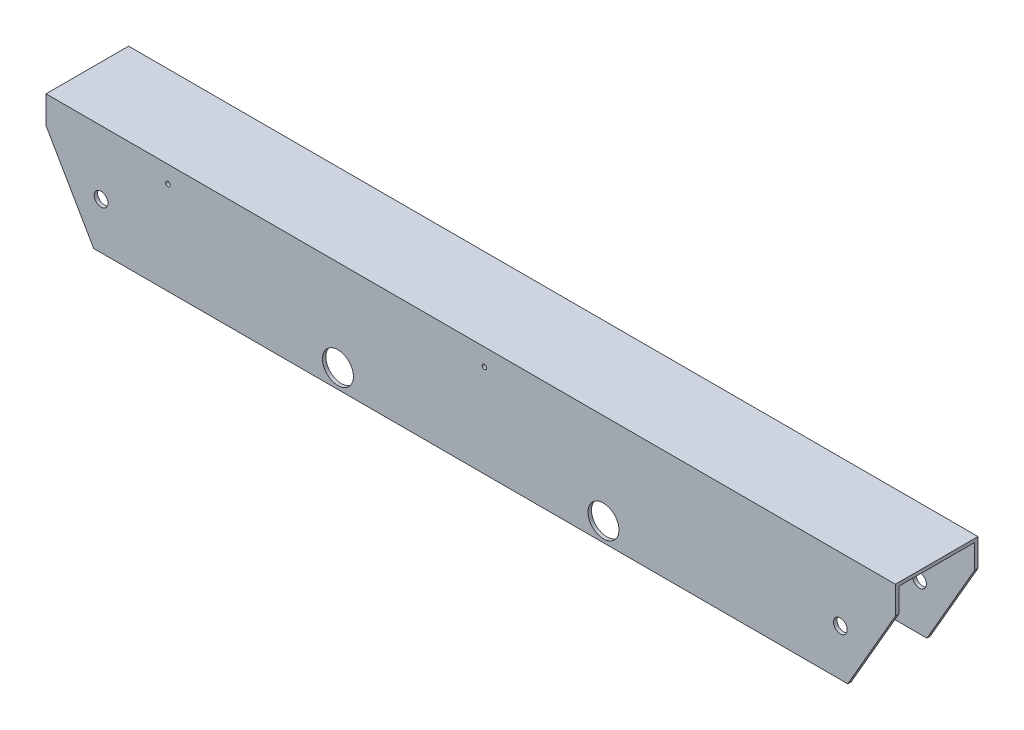
from build123d import *

# Parameters (mm, degrees)
BOSS_EXTRUDE1_DEPTH = 391.865756272
SKETCH2_R           = 6.35
SKETCH2_R_2         = 14.2875
SKETCH2_R_3         = 2.0828
CUT_EXTRUDE1_DEPTH  = 141.732
SKETCH14_R          = 3.302
SKETCH14_W          = 25.4
SKETCH14_H          = 25.4
CUT_EXTRUDE12_DEPTH = 23.114
CUT_EXTRUDE13_DEPTH = 101.6


with BuildPart() as part:
    # Sketch1 → Boss-Extrude1 (new, symmetric)
    with BuildSketch(Plane(origin=(0, 0, 0), x_dir=(0, 0, -1), z_dir=(1, 0, 0))):
        Polygon((-38.1, 50.8), (38.1, 50.8), (38.1, -50.8), (34.925, -50.8), (34.925, 47.625), (-34.925, 47.625), (-34.925, -50.8), (-38.1, -50.8), align=None)
    extrude(amount=BOSS_EXTRUDE1_DEPTH, both=True)

    # Sketch2 → Cut-Extrude1 (cut)
    with BuildSketch(Plane.XY.offset(38.1)):
        with Locations((-341.065756187, -7.9375)):
            Circle(SKETCH2_R)
        with Locations((122.51182, -33.3375)):
            Circle(SKETCH2_R_2)
        with Locations((341.065756187, -7.9375)):
            Circle(SKETCH2_R)
        with Locations((12.7, 34.925)):
            Circle(SKETCH2_R_3)
        with Locations((-279.4, 34.925)):
            Circle(SKETCH2_R_3)
        with Locations((-122.51182, -33.3375)):
            Circle(SKETCH2_R_2)
    extrude(amount=-CUT_EXTRUDE1_DEPTH, mode=Mode.SUBTRACT)

    # Sketch14 → Cut-Extrude12 (cut)
    with BuildSketch(Plane(origin=(0, 0, -38.1), x_dir=(-1, 0, 0), z_dir=(0, 0, -1))):
        with Locations((-160.61182, -35.123476108)):
            Circle(SKETCH14_R)
        with Locations((-160.61182, 41.076523892)):
            Circle(SKETCH14_R)
        with Locations((-84.41182, 41.076523892)):
            Circle(SKETCH14_R)
        with Locations((-84.41182, -35.123476108)):
            Circle(SKETCH14_R)
        with Locations((-12.7, 34.925)):
            Rectangle(SKETCH14_W, SKETCH14_H)
        with Locations((279.4, 34.925)):
            Rectangle(SKETCH14_W, SKETCH14_H)
    extrude(amount=-CUT_EXTRUDE12_DEPTH, mode=Mode.SUBTRACT)

    # Sketch16 → Cut-Extrude13 (cut)
    with BuildSketch(Plane.XY.offset(38.1)):
        Polygon((-391.865756272, 25.4), (-347.87166576, -50.8), (-391.865756272, -50.8), align=None)
        Polygon((347.87166576, -50.8), (391.865756272, -50.8), (391.865756272, 25.4), align=None)
    extrude(amount=-CUT_EXTRUDE13_DEPTH, mode=Mode.SUBTRACT)


solid = part.part
